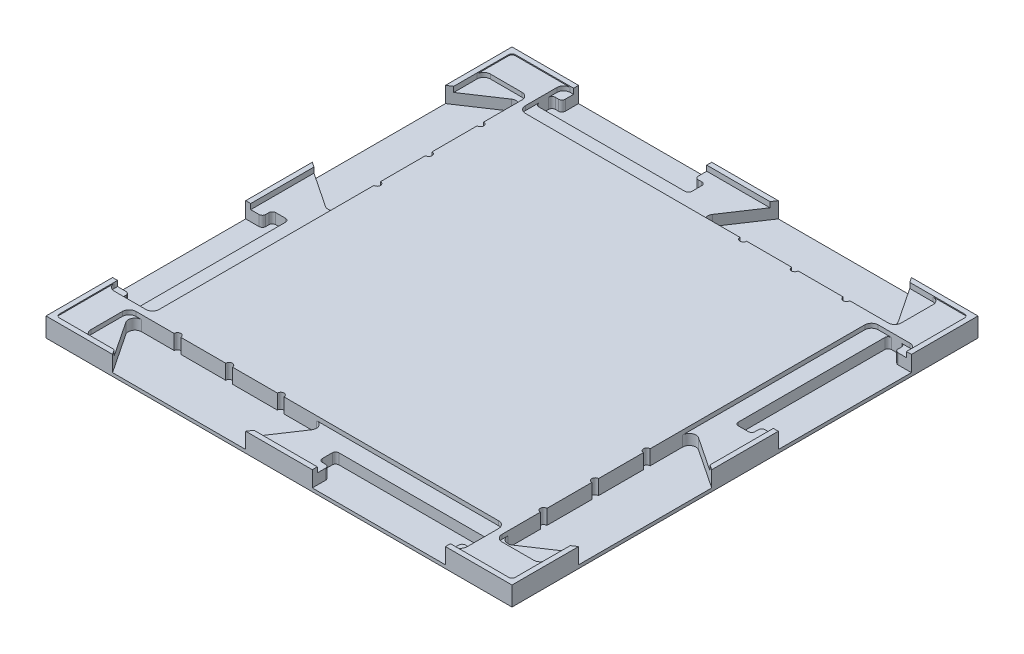
from build123d import *

# Parameters (mm, degrees)
SKETCH1_W           = 140
SKETCH1_H           = 140
BOSS_EXTRUDE1_DEPTH = 2.875
SKETCH2_W           = 137
SKETCH2_H           = 137
CUT_EXTRUDE1_DEPTH  = 0.3
CUT_EXTRUDE2_START  = -4.75
CUT_EXTRUDE2_DEPTH  = 104.9117996
CUT_EXTRUDE4_DEPTH  = 4.45
SKETCH9_W           = 113
SKETCH9_H           = 13.5
CUT_EXTRUDE5_DEPTH  = 1.3
FILLET1_R           = 1
FILLET3_R           = 2
FILLET4_R           = 2
CIRPATTERN1_START   = -1.875
CIRPATTERN1_DEPTH   = 4.75
CIRPATTERN1_START_2 = 1.275
CIRPATTERN1_2_DEPTH = 1.3


# Read off the part's stored shape, not the designer's step: CirPattern1
with BuildPart() as part:
    # Sketch1 → Boss-Extrude1 (new, symmetric)
    with BuildSketch(Plane(origin=(0, 0, 0), x_dir=(1, 0, 0), z_dir=(0, 1, 0))):
        Rectangle(SKETCH1_W, SKETCH1_H)
    extrude(amount=BOSS_EXTRUDE1_DEPTH, both=True)

    # Sketch2 → Cut-Extrude1 (cut)
    with BuildSketch(Plane(origin=(0, 2.875, 0), x_dir=(1, 0, 0), z_dir=(0, 1, 0))):
        Rectangle(SKETCH2_W, SKETCH2_H)
    extrude(amount=-CUT_EXTRUDE1_DEPTH, mode=Mode.SUBTRACT)

    # Sketch4 → Cut-Extrude2 (cut)
    with BuildSketch(Plane(origin=(0, 2.875, 0), x_dir=(1, 0, 0), z_dir=(0, 1, 0)).offset(CUT_EXTRUDE2_START)):
        Polygon((-50, -70), (-60, -55), (0, -55), (-10, -70), align=None)
        Polygon((10, -70), (10, -65), (7, -65), (7, -60), (53, -60), (53, -65), (50, -65), (50, -70), align=None)
    extrude(amount=CUT_EXTRUDE2_DEPTH, mode=Mode.SUBTRACT)

    # Sketch6 → Cut-Extrude4 (cut)
    with BuildSketch(Plane(origin=(0, 2.575, 0), x_dir=(1, 0, 0), z_dir=(0, 1, 0))):
        with BuildLine():
            Line((-46.5, -55), (-44.5, -55))
            ThreePointArc((-44.5, -55), (-45.5, -54), (-46.5, -55))
        make_face()
        with BuildLine():
            Line((-31, -55), (-29, -55))
            ThreePointArc((-29, -55), (-30, -54), (-31, -55))
        make_face()
        with BuildLine():
            Line((-15.5, -55), (-13.5, -55))
            ThreePointArc((-13.5, -55), (-14.5, -54), (-15.5, -55))
        make_face()
    extrude(amount=-CUT_EXTRUDE4_DEPTH, mode=Mode.SUBTRACT)

    # Sketch9 → Cut-Extrude5 (cut)
    with BuildSketch(Plane(origin=(0, 2.575, 0), x_dir=(1, 0, 0), z_dir=(0, 1, 0))):
        with Locations((-3.5, -61.75)):
            Rectangle(SKETCH9_W, SKETCH9_H)
    extrude(amount=-CUT_EXTRUDE5_DEPTH, mode=Mode.SUBTRACT)

    # Fillet1
    fillet1_edges = [part.edges().sort_by_distance(p)[0] for p in [
        (-68.5, 2.725, -68.5),
        (-68.5, 2.725, 68.5),
        (68.5, 2.725, 68.5),
        (68.5, 2.725, -68.5),
        (53, -0.3, 65),
        (53, -0.3, 60),
        (7, -0.3, 60),
        (7, -0.3, 65),
        (10, -0.3, 65),
        (50, -0.3, 65),
    ]]
    fillet(fillet1_edges, radius=FILLET1_R)

    # Fillet3
    fillet3_edges = [part.edges().sort_by_distance(p)[0] for p in [
        (-60, -0.3, 55),
        (0, -0.3, 55),
    ]]
    fillet(fillet3_edges, radius=FILLET3_R)

    # Fillet4
    fillet4_edges = [part.edges().sort_by_distance(p)[0] for p in [
        (53, 1.925, 55),
        (53, 1.925, 68.5),
        (-60, 1.925, 55),
        (-60, 1.925, 68.5),
    ]]
    fillet(fillet4_edges, radius=FILLET4_R)

    # CirPattern1 outline → CirPattern1 (cut)
    with BuildSketch(Plane(origin=(0, 0, 0), x_dir=(1, 0, 0), z_dir=(0, 1, 0)).offset(CIRPATTERN1_START)):
        with BuildLine():
            ThreePointArc((55, -13.5), (54, -14.5), (55, -15.5))
            Line((55, -15.5), (55, -29))
            ThreePointArc((55, -29), (54, -30), (55, -31))
            Line((55, -31), (55, -44.5))
            ThreePointArc((55, -44.5), (54, -45.5), (55, -46.5))
            Line((55, -46.5), (55, -56.262965816))
            ThreePointArc((55, -56.262965816), (56.056284149, -58.026315014), (58.109400392, -57.927066405))
            Line((58.109400392, -57.927066405), (70, -50))
            Line((70, -50), (70, -10))
            Line((70, -10), (58.109400392, -2.072933595))
            ThreePointArc((58.109400392, -2.072933595), (56.056284149, -1.973684986), (55, -3.737034184))
            Line((55, -3.737034184), (55, -13.5))
        make_face()
        with BuildLine():
            Line((-70, 50), (-70, 10))
            Line((-70, 10), (-58.109400392, 2.072933595))
            ThreePointArc((-58.109400392, 2.072933595), (-56.056284149, 1.973684986), (-55, 3.737034184))
            Line((-55, 3.737034184), (-55, 13.5))
            ThreePointArc((-55, 13.5), (-54, 14.5), (-55, 15.5))
            Line((-55, 15.5), (-55, 29))
            ThreePointArc((-55, 29), (-54, 30), (-55, 31))
            Line((-55, 31), (-55, 44.5))
            ThreePointArc((-55, 44.5), (-54, 45.5), (-55, 46.5))
            Line((-55, 46.5), (-55, 56.262965816))
            ThreePointArc((-55, 56.262965816), (-56.056284149, 58.026315014), (-58.109400392, 57.927066405))
            Line((-58.109400392, 57.927066405), (-70, 50))
        make_face()
        with BuildLine():
            Line((50, 70), (10, 70))
            Line((10, 70), (2.072933595, 58.109400392))
            ThreePointArc((2.072933595, 58.109400392), (1.973684986, 56.056284149), (3.737034184, 55))
            Line((3.737034184, 55), (13.5, 55))
            ThreePointArc((13.5, 55), (14.5, 54), (15.5, 55))
            Line((15.5, 55), (29, 55))
            ThreePointArc((29, 55), (30, 54), (31, 55))
            Line((31, 55), (44.5, 55))
            ThreePointArc((44.5, 55), (45.5, 54), (46.5, 55))
            Line((46.5, 55), (56.262965816, 55))
            ThreePointArc((56.262965816, 55), (58.026315014, 56.056284149), (57.927066405, 58.109400392))
            Line((57.927066405, 58.109400392), (50, 70))
        make_face()
        with BuildLine():
            Line((64, 53), (61, 53))
            ThreePointArc((61, 53), (60.292893219, 52.707106781), (60, 52))
            Line((60, 52), (60, 8))
            ThreePointArc((60, 8), (60.292893219, 7.292893219), (61, 7))
            Line((61, 7), (64, 7))
            ThreePointArc((64, 7), (64.707106781, 7.292893219), (65, 8))
            Line((65, 8), (65, 9))
            ThreePointArc((65, 9), (65.292893219, 9.707106781), (66, 10))
            Line((66, 10), (70, 10))
            Line((70, 10), (70, 50))
            Line((70, 50), (66, 50))
            ThreePointArc((66, 50), (65.292893219, 50.292893219), (65, 51))
            Line((65, 51), (65, 52))
            ThreePointArc((65, 52), (64.707106781, 52.707106781), (64, 53))
        make_face()
        with BuildLine():
            Line((-10, 70), (-50, 70))
            Line((-50, 70), (-50, 66))
            ThreePointArc((-50, 66), (-50.292893219, 65.292893219), (-51, 65))
            Line((-51, 65), (-52, 65))
            ThreePointArc((-52, 65), (-52.707106781, 64.707106781), (-53, 64))
            Line((-53, 64), (-53, 61))
            ThreePointArc((-53, 61), (-52.707106781, 60.292893219), (-52, 60))
            Line((-52, 60), (-8, 60))
            ThreePointArc((-8, 60), (-7.292893219, 60.292893219), (-7, 61))
            Line((-7, 61), (-7, 64))
            ThreePointArc((-7, 64), (-7.292893219, 64.707106781), (-8, 65))
            Line((-8, 65), (-9, 65))
            ThreePointArc((-9, 65), (-9.707106781, 65.292893219), (-10, 66))
            Line((-10, 66), (-10, 70))
        make_face()
        with BuildLine():
            Line((-70, -10), (-70, -50))
            Line((-70, -50), (-66, -50))
            ThreePointArc((-66, -50), (-65.292893219, -50.292893219), (-65, -51))
            Line((-65, -51), (-65, -52))
            ThreePointArc((-65, -52), (-64.707106781, -52.707106781), (-64, -53))
            Line((-64, -53), (-61, -53))
            ThreePointArc((-61, -53), (-60.292893219, -52.707106781), (-60, -52))
            Line((-60, -52), (-60, -8))
            ThreePointArc((-60, -8), (-60.292893219, -7.292893219), (-61, -7))
            Line((-61, -7), (-64, -7))
            ThreePointArc((-64, -7), (-64.707106781, -7.292893219), (-65, -8))
            Line((-65, -8), (-65, -9))
            ThreePointArc((-65, -9), (-65.292893219, -9.707106781), (-66, -10))
            Line((-66, -10), (-70, -10))
        make_face()
    extrude(amount=CIRPATTERN1_DEPTH, mode=Mode.SUBTRACT)

    # CirPattern1 2 outline → CirPattern1 2 (cut)
    with BuildSketch(Plane(origin=(0, 0, 0), x_dir=(1, 0, 0), z_dir=(0, 1, 0)).offset(CIRPATTERN1_START_2)):
        with BuildLine():
            Line((55, 51), (55, -3.737034184))
            ThreePointArc((55, -3.737034184), (56.056284149, -1.973684986), (58.109400392, -2.072933595))
            Line((58.109400392, -2.072933595), (68.5, -9))
            Line((68.5, -9), (68.5, 10))
            Line((68.5, 10), (66, 10))
            ThreePointArc((66, 10), (65.292893219, 9.707106781), (65, 9))
            Line((65, 9), (65, 8))
            ThreePointArc((65, 8), (64.707106781, 7.292893219), (64, 7))
            Line((64, 7), (61, 7))
            ThreePointArc((61, 7), (60.292893219, 7.292893219), (60, 8))
            Line((60, 8), (60, 52))
            ThreePointArc((60, 52), (60.292893219, 52.707106781), (61, 53))
            Line((61, 53), (57, 53))
            ThreePointArc((57, 53), (55.585786438, 52.414213562), (55, 51))
        make_face()
        with BuildLine():
            ThreePointArc((58.109400392, -57.927066405), (56.056284149, -58.026315014), (55, -56.262965816))
            Line((55, -56.262965816), (55, -58))
            ThreePointArc((55, -58), (55.585786438, -59.414213562), (57, -60))
            Line((57, -60), (66.5, -60))
            ThreePointArc((66.5, -60), (67.914213562, -59.414213562), (68.5, -58))
            Line((68.5, -58), (68.5, -51))
            Line((68.5, -51), (58.109400392, -57.927066405))
        make_face()
        with BuildLine():
            Line((66.5, 53), (64, 53))
            ThreePointArc((64, 53), (64.707106781, 52.707106781), (65, 52))
            Line((65, 52), (65, 51))
            ThreePointArc((65, 51), (65.292893219, 50.292893219), (66, 50))
            Line((66, 50), (68.5, 50))
            Line((68.5, 50), (68.5, 51))
            ThreePointArc((68.5, 51), (67.914213562, 52.414213562), (66.5, 53))
        make_face()
        with BuildLine():
            Line((58, 68.5), (51, 68.5))
            Line((51, 68.5), (57.927066405, 58.109400392))
            ThreePointArc((57.927066405, 58.109400392), (58.026315014, 56.056284149), (56.262965816, 55))
            Line((56.262965816, 55), (58, 55))
            ThreePointArc((58, 55), (59.414213562, 55.585786438), (60, 57))
            Line((60, 57), (60, 66.5))
            ThreePointArc((60, 66.5), (59.414213562, 67.914213562), (58, 68.5))
        make_face()
        with BuildLine():
            Line((2.072933595, 58.109400392), (9, 68.5))
            Line((9, 68.5), (-10, 68.5))
            Line((-10, 68.5), (-10, 66))
            ThreePointArc((-10, 66), (-9.707106781, 65.292893219), (-9, 65))
            Line((-9, 65), (-8, 65))
            ThreePointArc((-8, 65), (-7.292893219, 64.707106781), (-7, 64))
            Line((-7, 64), (-7, 61))
            ThreePointArc((-7, 61), (-7.292893219, 60.292893219), (-8, 60))
            Line((-8, 60), (-52, 60))
            ThreePointArc((-52, 60), (-52.707106781, 60.292893219), (-53, 61))
            Line((-53, 61), (-53, 57))
            ThreePointArc((-53, 57), (-52.414213562, 55.585786438), (-51, 55))
            Line((-51, 55), (3.737034184, 55))
            ThreePointArc((3.737034184, 55), (1.973684986, 56.056284149), (2.072933595, 58.109400392))
        make_face()
        with BuildLine():
            Line((-50, 66), (-50, 68.5))
            Line((-50, 68.5), (-51, 68.5))
            ThreePointArc((-51, 68.5), (-52.414213562, 67.914213562), (-53, 66.5))
            Line((-53, 66.5), (-53, 64))
            ThreePointArc((-53, 64), (-52.707106781, 64.707106781), (-52, 65))
            Line((-52, 65), (-51, 65))
            ThreePointArc((-51, 65), (-50.292893219, 65.292893219), (-50, 66))
        make_face()
        with BuildLine():
            Line((-68.5, 58), (-68.5, 51))
            Line((-68.5, 51), (-58.109400392, 57.927066405))
            ThreePointArc((-58.109400392, 57.927066405), (-56.056284149, 58.026315014), (-55, 56.262965816))
            Line((-55, 56.262965816), (-55, 58))
            ThreePointArc((-55, 58), (-55.585786438, 59.414213562), (-57, 60))
            Line((-57, 60), (-66.5, 60))
            ThreePointArc((-66.5, 60), (-67.914213562, 59.414213562), (-68.5, 58))
        make_face()
        with BuildLine():
            Line((-58.109400392, 2.072933595), (-68.5, 9))
            Line((-68.5, 9), (-68.5, -10))
            Line((-68.5, -10), (-66, -10))
            ThreePointArc((-66, -10), (-65.292893219, -9.707106781), (-65, -9))
            Line((-65, -9), (-65, -8))
            ThreePointArc((-65, -8), (-64.707106781, -7.292893219), (-64, -7))
            Line((-64, -7), (-61, -7))
            ThreePointArc((-61, -7), (-60.292893219, -7.292893219), (-60, -8))
            Line((-60, -8), (-60, -52))
            ThreePointArc((-60, -52), (-60.292893219, -52.707106781), (-61, -53))
            Line((-61, -53), (-57, -53))
            ThreePointArc((-57, -53), (-55.585786438, -52.414213562), (-55, -51))
            Line((-55, -51), (-55, 3.737034184))
            ThreePointArc((-55, 3.737034184), (-56.056284149, 1.973684986), (-58.109400392, 2.072933595))
        make_face()
        with BuildLine():
            Line((-66, -50), (-68.5, -50))
            Line((-68.5, -50), (-68.5, -51))
            ThreePointArc((-68.5, -51), (-67.914213562, -52.414213562), (-66.5, -53))
            Line((-66.5, -53), (-64, -53))
            ThreePointArc((-64, -53), (-64.707106781, -52.707106781), (-65, -52))
            Line((-65, -52), (-65, -51))
            ThreePointArc((-65, -51), (-65.292893219, -50.292893219), (-66, -50))
        make_face()
    extrude(amount=CIRPATTERN1_2_DEPTH, mode=Mode.SUBTRACT)


solid = part.part
